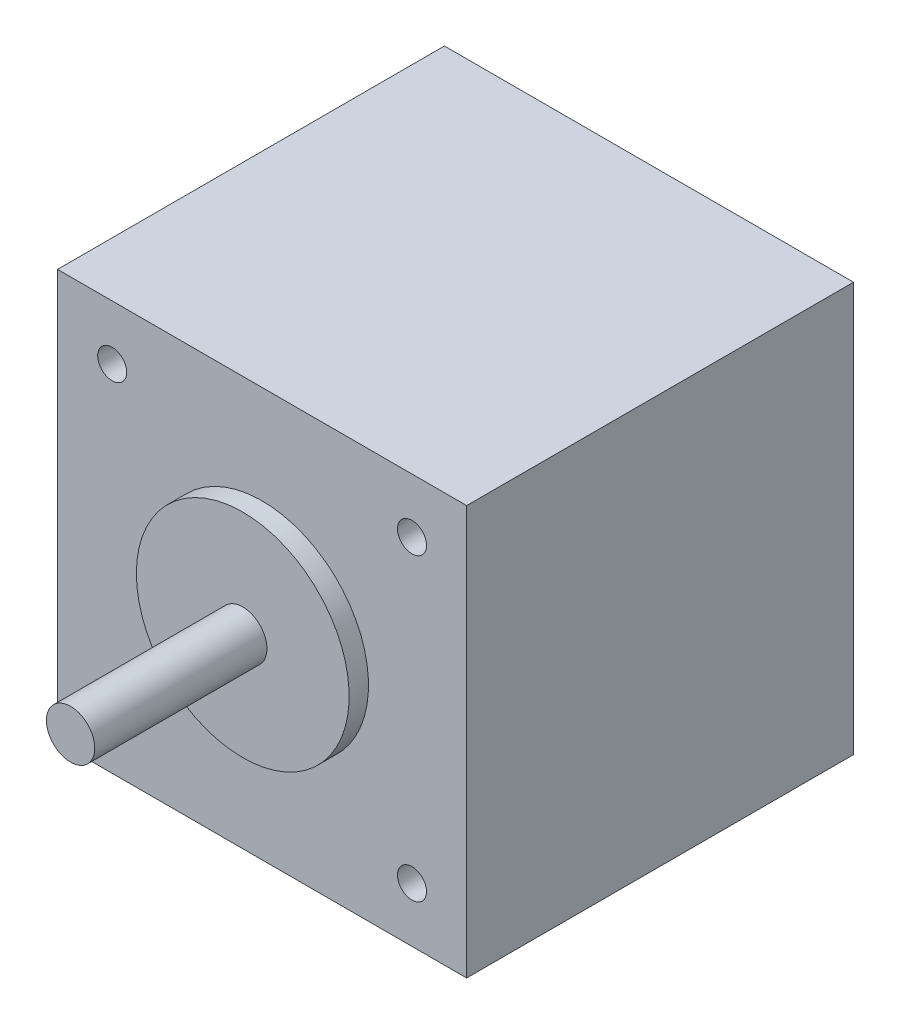
from build123d import *

# Parameters (mm, degrees)
SKETCH_1_W          = 42.3
SKETCH_1_H          = 42.3
EXTRUDE_1265_DEPTH  = 40
SKETCH_2_R          = 2.5
EXTRUDE_1320_DEPTH  = 59.8
SKETCH_3_R          = 11
EXTRUDE_1367_DEPTH  = 42
CUT_EXTRUDE_START   = 40
SKETCH_5_R          = 1.5
CUT_EXTRUDE_3_DEPTH = 4.5


with BuildPart() as part:
    # Эскиз1 → Extrude 1265 (new body)
    with BuildSketch(Plane.XY):
        Rectangle(SKETCH_1_W, SKETCH_1_H)
    extrude(amount=EXTRUDE_1265_DEPTH)

    # Эскиз2 → Extrude 1320 (add)
    with BuildSketch(Plane.XY):
        Circle(SKETCH_2_R)
    extrude(amount=EXTRUDE_1320_DEPTH)

    # Эскиз3 → Extrude 1367 (add)
    with BuildSketch(Plane.XY):
        Circle(SKETCH_3_R)
    extrude(amount=EXTRUDE_1367_DEPTH)

    # Эскиз5 → Крепеж_М3_ПРЕДВ (cut)
    with BuildSketch(Plane.XY.offset(CUT_EXTRUDE_START)):
        with Locations((-15.5, -15.5)):
            Circle(SKETCH_5_R)
        with Locations((-15.5, 15.5)):
            Circle(SKETCH_5_R)
        with Locations((15.5, -15.5)):
            Circle(SKETCH_5_R)
        with Locations((15.5, 15.5)):
            Circle(SKETCH_5_R)
    extrude(amount=-CUT_EXTRUDE_3_DEPTH, mode=Mode.SUBTRACT)


solid = part.part
